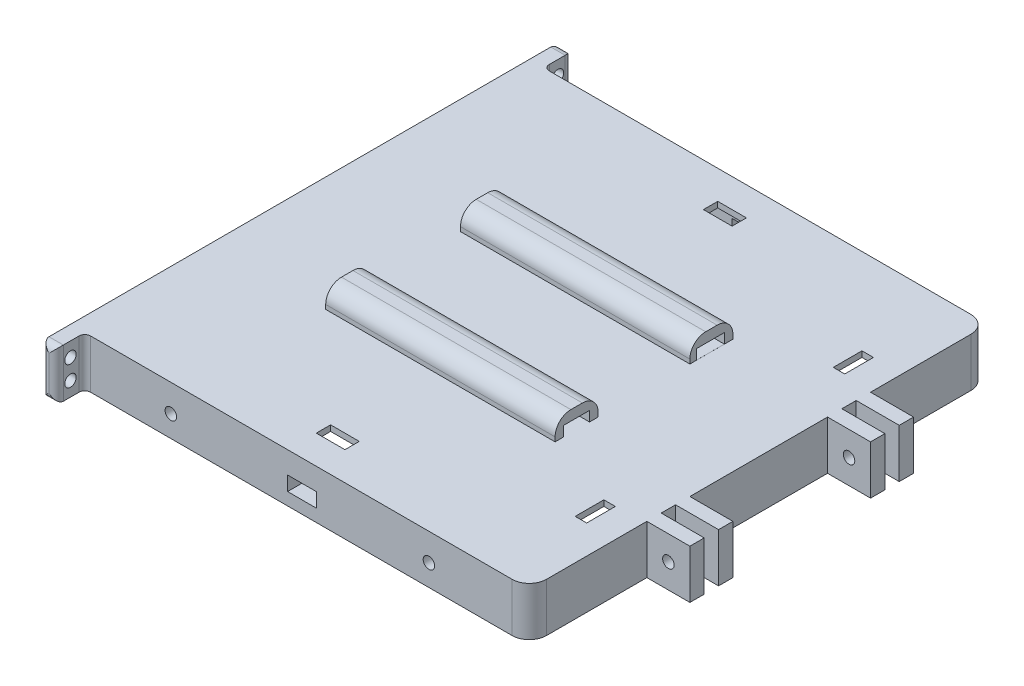
from build123d import *

# Parameters (mm, degrees)
SKETCH1_W                = 406.4
SKETCH1_H                = 406.4
SKETCH1_W_2              = 381
SKETCH1_H_2              = 381
BOSS_EXTRUDE2_DEPTH      = 38.1
SKETCH2_W                = 406.4
SKETCH2_H                = 406.4
BOSS_EXTRUDE3_DEPTH      = 5.08
CUT_EXTRUDE3_DEPTH       = 5.08
CUT_EXTRUDE4_DEPTH       = 446.859951222
CUT_EXTRUDE4_DEPTH_BACK  = 446.859951222
SKETCH6_R                = 5.08
CUT_EXTRUDE6_DEPTH       = 5.08
SKETCH8_W                = 457.2
SKETCH8_H                = 43.18
BOSS_EXTRUDE4_DEPTH      = 12.7
SKETCH9_R                = 5.08
CUT_EXTRUDE7_DEPTH       = 462.214953622
FILLET2_R                = 15.24
FILLET3_R                = 5.08
FILLET4_R                = 6.35
CUT_EXTRUDE8_DEPTH       = 473.102217157
CUT_EXTRUDE8_DEPTH_BACK  = 473.102217157
SKETCH10_W               = 25.4
SKETCH10_H               = 10.16
CUT_EXTRUDE9_DEPTH       = 316.013546928
CUT_EXTRUDE9_DEPTH_BACK  = 316.013546928
SKETCH11_W               = 10.16
SKETCH11_H               = 25.4
SKETCH13_W               = 38.1
SKETCH13_H               = 17.78
BOSS_EXTRUDE6_DEPTH      = 406.4
FILLET5_R                = 13.97
CUT_EXTRUDE10_DEPTH      = 475.059186858
CUT_EXTRUDE10_DEPTH_BACK = 101.6
SKETCH14_W               = 157.48
SKETCH14_H               = 20.829558228
SKETCH17_W               = 157.48
SKETCH17_H               = 21.78032637
CUT_EXTRUDE11_DEPTH      = 101.6
BOSS_EXTRUDE7_START      = -12.7
SKETCH18_W               = 375.92
SKETCH18_H               = 43.18
BOSS_EXTRUDE7_DEPTH      = 12.7
SKETCH19_W               = 12.7
SKETCH19_H               = 43.18
BOSS_EXTRUDE8_DEPTH      = 38.1
SKETCH20_R               = 5.08
CUT_EXTRUDE12_DEPTH      = 413.381445795
SKETCH21_W               = 23.212308842
SKETCH21_H               = 297.780762004
BOSS_EXTRUDE10_DEPTH     = 5.08
SKETCH22_W               = 25.4
SKETCH22_H               = 12.7
CUT_EXTRUDE13_DEPTH      = 500.147895153
SKETCH23_W               = 25.4
SKETCH23_H               = 12.7
CUT_EXTRUDE14_DEPTH      = 342.010118149


with BuildPart() as part:
    # Sketch1 → Boss-Extrude2 (new body)
    with BuildSketch(Plane(origin=(0, 0, 0), x_dir=(1, 0, 0), z_dir=(0, 1, 0))):
        with Locations((1.560576536, -7.736690009)):
            Rectangle(SKETCH1_W, SKETCH1_H)
        with Locations((1.560576536, -7.736690009)):
            Rectangle(SKETCH1_W_2, SKETCH1_H_2, mode=Mode.SUBTRACT)
    extrude(amount=BOSS_EXTRUDE2_DEPTH)

    # Sketch2 → Boss-Extrude3 (add)
    with BuildSketch(Plane(origin=(0, 38.1, 0), x_dir=(1, 0, 0), z_dir=(0, 1, 0))):
        with Locations((1.560576536, -7.736690009)):
            Rectangle(SKETCH2_W, SKETCH2_H)
    extrude(amount=BOSS_EXTRUDE3_DEPTH)

    # Sketch5 → Cut-Extrude3 (cut)
    with BuildSketch(Plane(origin=(0, 0, 198.236690009), x_dir=(-1, 0, 0), z_dir=(0, 0, -1))):
        Polygon((-115.860576536, 8.577585816), (-106.791199814, 13.813792908), (-106.791199814, 24.286207092), (-115.860576536, 29.522414184), (-124.929953259, 24.286207092), (-124.929953259, 13.813792908), align=None)
        Polygon((112.739423464, 29.522414184), (103.670046741, 24.286207092), (103.670046741, 13.813792908), (112.739423464, 8.577585816), (121.808800186, 13.813792908), (121.808800186, 24.286207092), align=None)
    extrude(amount=-CUT_EXTRUDE3_DEPTH, mode=Mode.SUBTRACT)

    # Sketch6 → Cut-Extrude4 (cut, two sides: drawn at the far end of the back side and taken through both)
    with BuildSketch(Plane(origin=(0, 0, 198.236690009), x_dir=(-1, 0, 0), z_dir=(0, 0, -1)).offset(-CUT_EXTRUDE4_DEPTH_BACK)):
        with Locations((-115.860576536, 19.05)):
            Circle(SKETCH6_R)
        with Locations((112.739423464, 19.05)):
            Circle(SKETCH6_R)
    extrude(amount=CUT_EXTRUDE4_DEPTH + CUT_EXTRUDE4_DEPTH_BACK, mode=Mode.SUBTRACT)

    # Sketch7 → Cut-Extrude6 (cut)
    with BuildSketch(Plane.XY.offset(-182.763309991)):
        Polygon((-112.739423464, 29.522414184), (-121.808800186, 24.286207092), (-121.808800186, 13.813792908), (-112.739423464, 8.577585816), (-103.670046741, 13.813792908), (-103.670046741, 24.286207092), align=None)
        Polygon((115.860576536, 29.522414184), (106.791199814, 24.286207092), (106.791199814, 13.813792908), (115.860576536, 8.577585816), (124.929953259, 13.813792908), (124.929953259, 24.286207092), align=None)
    extrude(amount=-CUT_EXTRUDE6_DEPTH, mode=Mode.SUBTRACT)

    # Sketch8 → Boss-Extrude4 (add)
    with BuildSketch(Plane.ZY.offset(201.639423464)):
        with Locations((7.736690009, 21.59)):
            Rectangle(SKETCH8_W, SKETCH8_H)
    extrude(amount=-BOSS_EXTRUDE4_DEPTH)

    # Sketch9 → Cut-Extrude7 (cut, through all)
    with BuildSketch(Plane(origin=(-188.939423464, 0, 0), x_dir=(0, 0, -1), z_dir=(1, 0, 0))):
        with Locations((208.163309991, 30.48)):
            Circle(SKETCH9_R)
        with Locations((-223.636690009, 30.48)):
            Circle(SKETCH9_R)
        with Locations((-223.636690009, 12.7)):
            Circle(SKETCH9_R)
        with Locations((208.163309991, 12.7)):
            Circle(SKETCH9_R)
    extrude(amount=-CUT_EXTRUDE7_DEPTH, mode=Mode.SUBTRACT)

    # Fillet2
    fillet2_edges = [part.edges().sort_by_distance(p)[0] for p in [
        (204.760576536, 21.59, 210.936690009),
        (204.760576536, 21.59, -195.463309991),
    ]]
    fillet(fillet2_edges, radius=FILLET2_R)

    # Fillet3
    fillet3_edges = [part.edges().sort_by_distance(p)[0] for p in [
        (-188.939423464, 21.59, -195.463309991),
        (-188.939423464, 21.59, 210.936690009),
    ]]
    fillet(fillet3_edges, radius=FILLET3_R)

    # Fillet4
    fillet4_edges = [part.edges().sort_by_distance(p)[0] for p in [
        (-195.289423464, 43.18, -220.863309991),
        (-195.289423464, 0, 236.336690009),
        (-201.639423464, 21.59, -220.863309991),
        (-201.639423464, 21.59, 236.336690009),
        (-188.939423464, 21.59, -220.863309991),
        (-195.289423464, 0, -220.863309991),
        (-188.939423464, 21.59, 236.336690009),
        (-195.289423464, 43.18, 236.336690009),
    ]]
    fillet(fillet4_edges, radius=FILLET4_R - 0.0001)  # a hair under: the kernel refuses the full size

    # Sketch10 → Cut-Extrude8 (cut, two sides: drawn at the far end of the back side and taken through both)
    with BuildSketch(Plane(origin=(204.760576536, 0, 0), x_dir=(0, 0, -1), z_dir=(1, 0, 0)).offset(-CUT_EXTRUDE8_DEPTH_BACK)):
        with Locations((-122.036690009, 17.78)):
            Rectangle(SKETCH10_W, SKETCH10_H)
        with Locations((106.563309991, 17.78)):
            Rectangle(SKETCH10_W, SKETCH10_H)
    extrude(amount=CUT_EXTRUDE8_DEPTH + CUT_EXTRUDE8_DEPTH_BACK, mode=Mode.SUBTRACT)

    # Sketch11 → Cut-Extrude9 (cut, two sides: drawn at the far end of the back side and taken through both)
    with BuildSketch(Plane(origin=(0, 38.1, 0), x_dir=(-1, 0, 0), z_dir=(0, -1, 0)).offset(-CUT_EXTRUDE9_DEPTH_BACK)):
        with Locations((-174.280576536, -122.036690009)):
            Rectangle(SKETCH11_W, SKETCH11_H)
        with Locations((171.159423464, -122.036690009)):
            Rectangle(SKETCH11_W, SKETCH11_H)
        with Locations((-174.280576536, 106.563309991)):
            Rectangle(SKETCH11_W, SKETCH11_H)
        with Locations((171.159423464, 106.563309991)):
            Rectangle(SKETCH11_W, SKETCH11_H)
    extrude(amount=CUT_EXTRUDE9_DEPTH + CUT_EXTRUDE9_DEPTH_BACK, mode=Mode.SUBTRACT)

    # Sketch13 → Boss-Extrude6 (add, through all)
    # profile 1 of 2: a face of its own
    with BuildSketch(Plane(origin=(204.760576536, 0, 0), x_dir=(0, 0, -1), z_dir=(1, 0, 0))):
        Polygon((-86.476690009, 60.96), (-86.476690009, 43.18), (-78.856690009, 43.18), (-78.856690009, 47.73825334), (-78.856690009, 52.07), (-55.996690009, 52.07), (-55.996690009, 48.121507739), (-55.996690009, 43.18), (-48.376690009, 43.18), (-48.376690009, 60.96), align=None)
    # profile 2 of 2: a face of its own
    with BuildSketch(Plane(origin=(204.760576536, 0, 0), x_dir=(0, 0, -1), z_dir=(1, 0, 0))):
        with Locations((51.953309991, 52.07)):
            Rectangle(SKETCH13_W, SKETCH13_H)
        Polygon((38.583459735, 43.205405435), (38.583459735, 47.763658775), (38.583459735, 52.07), (63.41669047, 52.07), (63.41669047, 47.763658775), (63.41669047, 43.205405435), align=None, mode=Mode.SUBTRACT)
    extrude(amount=-BOSS_EXTRUDE6_DEPTH)

    # Fillet5
    fillet5_edges = [part.edges().sort_by_distance(p)[0] for p in [
        (1.560576536, 60.96, 86.476690009),
        (1.560576536, 60.96, 48.376690009),
        (1.560576536, 60.96, -32.903309991),
        (1.560576536, 60.96, -71.003309991),
    ]]
    fillet(fillet5_edges, radius=FILLET5_R)

    # Sketch14 → Cut-Extrude10 (cut, two sides: drawn at the far end of the back side and taken through both)
    with BuildSketch(Plane.ZY.offset(201.639423464).offset(-CUT_EXTRUDE10_DEPTH_BACK)):
        with Locations((7.736690009, 53.594779114)):
            Rectangle(SKETCH14_W, SKETCH14_H)
    extrude(amount=CUT_EXTRUDE10_DEPTH + CUT_EXTRUDE10_DEPTH_BACK, mode=Mode.SUBTRACT)

    # Sketch17 → Cut-Extrude11 (cut)
    with BuildSketch(Plane(origin=(204.760576536, 0, 0), x_dir=(0, 0, -1), z_dir=(1, 0, 0))):
        with Locations((-7.736690009, 54.070163185)):
            Rectangle(SKETCH17_W, SKETCH17_H)
    extrude(amount=-CUT_EXTRUDE11_DEPTH, mode=Mode.SUBTRACT)

    # Sketch18 → Boss-Extrude7 (add)
    with BuildSketch(Plane(origin=(204.760576536, 0, 0), x_dir=(0, 0, -1), z_dir=(1, 0, 0)).offset(BOSS_EXTRUDE7_START)):
        with Locations((-7.736690009, 21.59)):
            Rectangle(SKETCH18_W, SKETCH18_H)
    extrude(amount=BOSS_EXTRUDE7_DEPTH)

    # Sketch19 → Boss-Extrude8 (add)
    with BuildSketch(Plane(origin=(204.760576536, 0, 0), x_dir=(0, 0, -1), z_dir=(1, 0, 0))):
        with Locations((84.973309991, 21.59)):
            Rectangle(SKETCH19_W, SKETCH19_H)
        with Locations((-100.446690009, 21.59)):
            Rectangle(SKETCH19_W, SKETCH19_H)
        with Locations((59.573309991, 21.59)):
            Rectangle(SKETCH19_W, SKETCH19_H)
        with Locations((-75.046690009, 21.59)):
            Rectangle(SKETCH19_W, SKETCH19_H)
    extrude(amount=BOSS_EXTRUDE8_DEPTH)

    # Sketch20 → Cut-Extrude12 (cut, through all)
    with BuildSketch(Plane.XY.offset(106.796690009)):
        with Locations((223.810576536, 21.59)):
            Circle(SKETCH20_R)
    extrude(amount=-CUT_EXTRUDE12_DEPTH, mode=Mode.SUBTRACT)

    # Sketch21 → Boss-Extrude10 (add)
    with BuildSketch(Plane.XZ.offset(-38.1)):
        with Locations((-170.393564794, 16.358404722)):
            Rectangle(SKETCH21_W, SKETCH21_H)
    extrude(amount=-BOSS_EXTRUDE10_DEPTH)

    # Sketch22 → Cut-Extrude13 (cut, through all)
    with BuildSketch(Plane(origin=(0, 0, -195.463309991), x_dir=(-1, 0, 0), z_dir=(0, 0, -1))):
        with Locations((-3.365108494, 17.400361313)):
            Rectangle(SKETCH22_W, SKETCH22_H)
    extrude(amount=-CUT_EXTRUDE13_DEPTH, mode=Mode.SUBTRACT)

    # Sketch23 → Cut-Extrude14 (cut, through all)
    with BuildSketch(Plane(origin=(0, 38.1, 0), x_dir=(-1, 0, 0), z_dir=(0, -1, 0))):
        with Locations((-3.365108494, -179.186690009)):
            Rectangle(SKETCH23_W, SKETCH23_H)
        with Locations((-3.365108494, 163.713309991)):
            Rectangle(SKETCH23_W, SKETCH23_H)
    extrude(amount=-CUT_EXTRUDE14_DEPTH, mode=Mode.SUBTRACT)


solid = part.part
